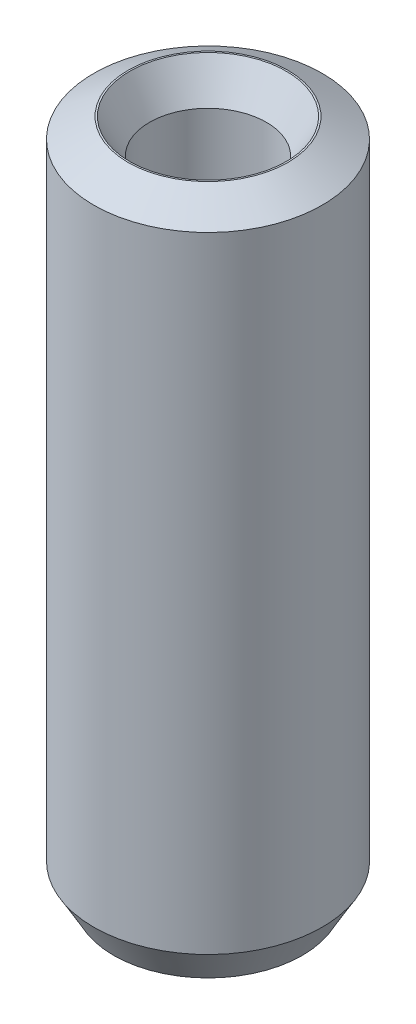
from build123d import *
from OCP.BRepFilletAPI import BRepFilletAPI_MakeChamfer

# Parameters (mm, degrees)
SKETCH1_R           = 15
BOSS_EXTRUDE1_DEPTH = 89.221552002
SKETCH2_R           = 7.674658731
CUT_EXTRUDE1_DEPTH  = 92.708698287
CHAMFER1_SIZE       = 2.602580143
CHAMFER1_SIZE2      = 4.507801038


with BuildPart() as part:
    # Sketch1 → Boss-Extrude1 (new body)
    with BuildSketch(Plane(origin=(0, 0, 0), x_dir=(1, 0, 0), z_dir=(0, 1, 0))):
        Circle(SKETCH1_R)
    extrude(amount=BOSS_EXTRUDE1_DEPTH)

    # Sketch2 → Cut-Extrude1 (cut, through all)
    with BuildSketch(Plane(origin=(0, 0, 0), x_dir=(1, 0, 0), z_dir=(0, 1, 0))):
        Circle(SKETCH2_R)
    extrude(amount=CUT_EXTRUDE1_DEPTH, mode=Mode.SUBTRACT)

    # Chamfer1: one chamfer whose edges measure the first distance from different faces: ONE call of the kernel's chamfer builder (chamfer() names one face for all edges)
    chamfer1_edges_1 = [part.edges().sort_by_distance(p)[0] for p in [
        (-7.674658731, 89.221552002, 0),
    ]]
    chamfer1_side_1 = [part.faces().sort_by_distance(p)[0] for p in [
        (-14.575735931, 89.221552002, 0),
    ]]
    chamfer1_edges_2 = [part.edges().sort_by_distance(p)[0] for p in [
        (-7.674658731, 0, 0),
    ]]
    chamfer1_side_2 = [part.faces().sort_by_distance(p)[0] for p in [
        (-7.674658731, 44.610776001, 0),
    ]]
    chamfer1_edges_3 = [part.edges().sort_by_distance(p)[0] for p in [
        (-15, 0, 0),
    ]]
    chamfer1_side_3 = [part.faces().sort_by_distance(p)[0] for p in [
        (-14.575735931, 0, 0),
    ]]
    chamfer1_edges_4 = [part.edges().sort_by_distance(p)[0] for p in [
        (-15, 89.221552002, 0),
    ]]
    chamfer1_side_4 = [part.faces().sort_by_distance(p)[0] for p in [
        (-15, 44.610776001, 0),
    ]]
    chamfer1 = BRepFilletAPI_MakeChamfer(part.part.solid().wrapped)
    for e in chamfer1_edges_1:
        chamfer1.Add(CHAMFER1_SIZE, CHAMFER1_SIZE2, e.wrapped, chamfer1_side_1[0].wrapped)  # the first distance lies on this face
    for e in chamfer1_edges_2:
        chamfer1.Add(CHAMFER1_SIZE, CHAMFER1_SIZE2, e.wrapped, chamfer1_side_2[0].wrapped)  # the first distance lies on this face
    for e in chamfer1_edges_3:
        chamfer1.Add(CHAMFER1_SIZE, CHAMFER1_SIZE2, e.wrapped, chamfer1_side_3[0].wrapped)  # the first distance lies on this face
    for e in chamfer1_edges_4:
        chamfer1.Add(CHAMFER1_SIZE, CHAMFER1_SIZE2, e.wrapped, chamfer1_side_4[0].wrapped)  # the first distance lies on this face
    add(Compound.cast(chamfer1.Shape()), mode=Mode.REPLACE)


solid = part.part
